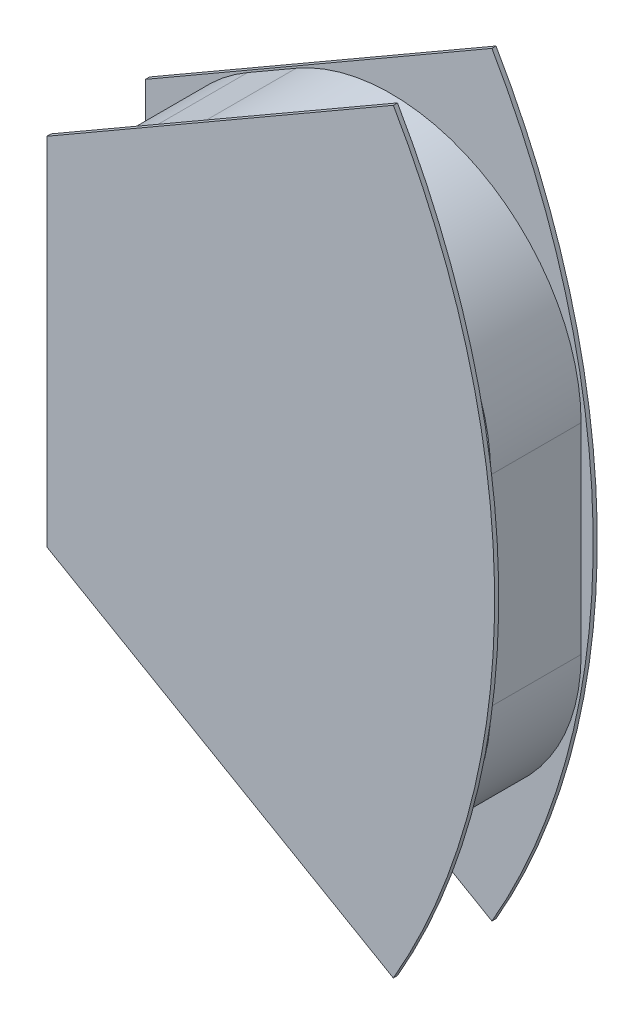
from build123d import *

# Parameters (mm, degrees)
BOSS_EXTRUDE1_START     = 20
BOSS_EXTRUDE1_DEPTH     = 1
BOSS_EXTRUDE2_DEPTH     = 22
SKETCH3_3_R             = 3.1
CUT_EXTRUDE1_DEPTH      = 10
BOSS_EXTRUDE3_START     = 22
SKETCH4_R               = 6.906241286
SKETCH4_R_2             = 3.1
BOSS_EXTRUDE3_DEPTH     = 22
BOSS_EXTRUDE4_START     = 1
BOSS_EXTRUDE4_DEPTH     = 22
BOSS_EXTRUDE4_2_DEPTH   = 22
BOSS_EXTRUDE5_DEPTH     = 1
BOSS_EXTRUDE6_START     = 0.5
BOSS_EXTRUDE6_DEPTH     = 22
CUT_EXTRUDE_THIN3_DEPTH = 22


with BuildPart() as part:
    # Sketch2 → Boss-Extrude1 (new body)
    with BuildSketch(Plane.XY.offset(BOSS_EXTRUDE1_START)):
        with BuildLine():
            Line((159.348674296, -92), (75, -43.301270189))
            Line((75, -43.301270189), (75, 43.301270189))
            Line((75, 43.301270189), (159.348674296, 92))
            ThreePointArc((159.348674296, 92), (184, 0), (159.348674296, -92))
        make_face()
    extrude(amount=BOSS_EXTRUDE1_DEPTH)

    # Sketch3 → Boss-Extrude2 (add)
    with BuildSketch(Plane.XY.offset(21)):
        with BuildLine():
            ThreePointArc((122.5, -17.60918321), (122.633974596, -18.10918321), (123, -18.475208614))
            Line((123, -18.475208614), (134.812482571, -25.295148606))
            ThreePointArc((134.812482571, -25.295148606), (135.812482571, -25.295148606), (136.312482571, -24.429123203))
            Line((136.312482571, -24.429123203), (136.312482571, 24.429123203))
            ThreePointArc((136.312482571, 24.429123203), (135.812482571, 25.295148606), (134.812482571, 25.295148606))
            Line((134.812482571, 25.295148606), (123, 18.475208614))
            ThreePointArc((123, 18.475208614), (122.633974596, 18.10918321), (122.5, 17.60918321))
            Line((122.5, 17.60918321), (122.5, -17.60918321))
        make_face()
        Polygon((134.312482571, 22.697072395), (134.312482571, -22.697072395), (124.5, -17.031832941), (124.5, 17.031832941), align=None, mode=Mode.SUBTRACT)
    extrude(amount=BOSS_EXTRUDE2_DEPTH)

    # Sketch3<3> → Cut-Extrude1 (cut)
    with BuildSketch(Plane.XY.offset(21)):
        with Locations((129.406241286, 0)):
            Circle(SKETCH3_3_R)
    extrude(amount=-CUT_EXTRUDE1_DEPTH, mode=Mode.SUBTRACT)

    # Sketch4 → Boss-Extrude3 (add)
    with BuildSketch(Plane.XY.offset(21).offset(BOSS_EXTRUDE3_START)):
        with Locations((129.406241286, 0)):
            Circle(SKETCH4_R)
        with Locations((129.406241286, 0)):
            Circle(SKETCH4_R_2, mode=Mode.SUBTRACT)
    extrude(amount=-BOSS_EXTRUDE3_DEPTH)


with BuildPart() as body_2:
    # Sketch5 → Boss-Extrude4 (new body)
    with BuildSketch(Plane.XY.offset(21).offset(BOSS_EXTRUDE4_START)):
        with BuildLine():
            Line((125, 16.743157806), (125, 5.952936058))
            ThreePointArc((125, 5.952936058), (129.406241286, 7.406241286), (133.812482571, 5.952936058))
            Line((133.812482571, 5.952936058), (133.812482571, 21.831046991))
            Line((133.812482571, 21.831046991), (125, 16.743157806))
        make_face()
    extrude(amount=BOSS_EXTRUDE4_DEPTH)



with BuildPart() as body_3:
    # Sketch5 → Boss-Extrude4 2 (new body)
    with BuildSketch(Plane.XY.offset(21).offset(BOSS_EXTRUDE4_START)):
        with BuildLine():
            Line((133.812482571, -21.831046991), (133.812482571, -5.952936058))
            ThreePointArc((133.812482571, -5.952936058), (129.406241286, -7.406241286), (125, -5.952936058))
            Line((125, -5.952936058), (125, -16.743157806))
            Line((125, -16.743157806), (133.812482571, -21.831046991))
        make_face()
    extrude(amount=BOSS_EXTRUDE4_2_DEPTH)


with BuildPart() as body_2_1:
    add(body_2.part)

    add(body_3.part)  # Boss-Extrude5 merges body 3
    # Sketch6 → Boss-Extrude5 (add)
    with BuildSketch(Plane.XY.offset(44)):
        with BuildLine():
            Line((159.348674296, 92), (75, 43.301270189))
            Line((75, 43.301270189), (75, -43.301270189))
            Line((75, -43.301270189), (159.348674296, -92))
            ThreePointArc((159.348674296, -92), (184, 0), (159.348674296, 92))
        make_face()
    extrude(amount=BOSS_EXTRUDE5_DEPTH)


with BuildPart() as body_3_2:
    # Sketch7 → Boss-Extrude6 (new body)
    with BuildSketch(Plane.XY.offset(21).offset(BOSS_EXTRUDE6_START)):
        with BuildLine():
            Line((181.562482571, -24.429123203), (181.562482571, 24.429123203))
            ThreePointArc((181.562482571, 24.429123203), (158.437482571, 64.482798128), (112.187482571, 64.482798128))
            Line((112.187482571, 64.482798128), (100.375, 57.662858135))
            ThreePointArc((100.375, 57.662858135), (83.446325075, 40.73418321), (77.25, 17.60918321))
            Line((77.25, 17.60918321), (77.25, -17.60918321))
            ThreePointArc((77.25, -17.60918321), (83.446325075, -40.73418321), (100.375, -57.662858135))
            Line((100.375, -57.662858135), (112.187482571, -64.482798128))
            ThreePointArc((112.187482571, -64.482798128), (158.437482571, -64.482798128), (181.562482571, -24.429123203))
        make_face()
        with BuildLine():
            ThreePointArc((136.562482571, 24.429123203), (135.937482571, 25.511654957), (134.687482571, 25.511654957))
            Line((134.687482571, 25.511654957), (122.875, 18.691714965))
            ThreePointArc((122.875, 18.691714965), (122.417468245, 18.23418321), (122.25, 17.60918321))
            Line((122.25, 17.60918321), (122.25, -17.60918321))
            ThreePointArc((122.25, -17.60918321), (122.417468245, -18.23418321), (122.875, -18.691714965))
            Line((122.875, -18.691714965), (134.687482571, -25.511654957))
            ThreePointArc((134.687482571, -25.511654957), (135.937482571, -25.511654957), (136.562482571, -24.429123203))
            Line((136.562482571, -24.429123203), (136.562482571, 24.429123203))
        make_face(mode=Mode.SUBTRACT)
    extrude(amount=BOSS_EXTRUDE6_DEPTH)

    # Sketch8 → Cut-Extrude-Thin3 (cut)
    # profile 1 of 26: a face of its own
    with BuildSketch(Plane.XY.offset(43.5)):
        with BuildLine():
            Line((113.212482571, 62.70744605), (101.4, 55.887506058))
            ThreePointArc((101.4, 55.887506058), (85.221677153, 39.70918321), (79.3, 17.60918321))
            Line((79.3, 17.60918321), (79.3, -17.60918321))
            ThreePointArc((79.3, -17.60918321), (85.221677153, -39.70918321), (101.4, -55.887506058))
            Line((101.4, -55.887506058), (113.212482571, -62.70744605))
            ThreePointArc((113.212482571, -62.70744605), (157.412482571, -62.70744605), (179.512482571, -24.429123203))
            Line((179.512482571, -24.429123203), (179.512482571, 24.429123203))
            ThreePointArc((179.512482571, 24.429123203), (157.412482571, 62.70744605), (113.212482571, 62.70744605))
        make_face()
        with BuildLine():
            Line((113.262482571, 62.620843509), (101.45, 55.800903517))
            ThreePointArc((101.45, 55.800903517), (85.308279693, 39.65918321), (79.4, 17.60918321))
            Line((79.4, 17.60918321), (79.4, -17.60918321))
            ThreePointArc((79.4, -17.60918321), (85.308279693, -39.65918321), (101.45, -55.800903517))
            Line((101.45, -55.800903517), (113.262482571, -62.620843509))
            ThreePointArc((113.262482571, -62.620843509), (157.362482571, -62.620843509), (179.412482571, -24.429123203))
            Line((179.412482571, -24.429123203), (179.412482571, 24.429123203))
            ThreePointArc((179.412482571, 24.429123203), (157.362482571, 62.620843509), (113.262482571, 62.620843509))
        make_face(mode=Mode.SUBTRACT)
    # profile 2 of 26: a face of its own
    with BuildSketch(Plane.XY.offset(43.5)):
        with BuildLine():
            Line((114.037482571, 61.278504134), (102.225, 54.458564141))
            ThreePointArc((102.225, 54.458564141), (86.650619069, 38.88418321), (80.95, 17.60918321))
            Line((80.95, 17.60918321), (80.95, -17.60918321))
            ThreePointArc((80.95, -17.60918321), (86.650619069, -38.88418321), (102.225, -54.458564141))
            Line((102.225, -54.458564141), (114.037482571, -61.278504134))
            ThreePointArc((114.037482571, -61.278504134), (156.587482571, -61.278504134), (177.862482571, -24.429123203))
            Line((177.862482571, -24.429123203), (177.862482571, 24.429123203))
            ThreePointArc((177.862482571, 24.429123203), (156.587482571, 61.278504134), (114.037482571, 61.278504134))
        make_face()
        with BuildLine():
            Line((114.087482571, 61.191901593), (102.275, 54.371961601))
            ThreePointArc((102.275, 54.371961601), (86.737221609, 38.83418321), (81.05, 17.60918321))
            Line((81.05, 17.60918321), (81.05, -17.60918321))
            ThreePointArc((81.05, -17.60918321), (86.737221609, -38.83418321), (102.275, -54.371961601))
            Line((102.275, -54.371961601), (114.087482571, -61.191901593))
            ThreePointArc((114.087482571, -61.191901593), (156.537482571, -61.191901593), (177.762482571, -24.429123203))
            Line((177.762482571, -24.429123203), (177.762482571, 24.429123203))
            ThreePointArc((177.762482571, 24.429123203), (156.537482571, 61.191901593), (114.087482571, 61.191901593))
        make_face(mode=Mode.SUBTRACT)
    # profile 3 of 26: a face of its own
    with BuildSketch(Plane.XY.offset(43.5)):
        with BuildLine():
            Line((114.862482571, 59.849562217), (103.05, 53.029622225))
            ThreePointArc((103.05, 53.029622225), (88.079560985, 38.05918321), (82.6, 17.60918321))
            Line((82.6, 17.60918321), (82.6, -17.60918321))
            ThreePointArc((82.6, -17.60918321), (88.079560985, -38.05918321), (103.05, -53.029622225))
            Line((103.05, -53.029622225), (114.862482571, -59.849562217))
            ThreePointArc((114.862482571, -59.849562217), (155.762482571, -59.849562217), (176.212482571, -24.429123203))
            Line((176.212482571, -24.429123203), (176.212482571, 24.429123203))
            ThreePointArc((176.212482571, 24.429123203), (155.762482571, 59.849562217), (114.862482571, 59.849562217))
        make_face()
        with BuildLine():
            Line((114.912482571, 59.762959677), (103.1, 52.943019685))
            ThreePointArc((103.1, 52.943019685), (88.166163526, 38.00918321), (82.7, 17.60918321))
            Line((82.7, 17.60918321), (82.7, -17.60918321))
            ThreePointArc((82.7, -17.60918321), (88.166163526, -38.00918321), (103.1, -52.943019685))
            Line((103.1, -52.943019685), (114.912482571, -59.762959677))
            ThreePointArc((114.912482571, -59.762959677), (155.712482571, -59.762959677), (176.112482571, -24.429123203))
            Line((176.112482571, -24.429123203), (176.112482571, 24.429123203))
            ThreePointArc((176.112482571, 24.429123203), (155.712482571, 59.762959677), (114.912482571, 59.762959677))
        make_face(mode=Mode.SUBTRACT)
    # profile 4 of 26: a face of its own
    with BuildSketch(Plane.XY.offset(43.5)):
        with BuildLine():
            Line((115.687482571, 58.420620301), (103.875, 51.600680309))
            ThreePointArc((103.875, 51.600680309), (89.508502901, 37.23418321), (84.25, 17.60918321))
            Line((84.25, 17.60918321), (84.25, -17.60918321))
            ThreePointArc((84.25, -17.60918321), (89.508502901, -37.23418321), (103.875, -51.600680309))
            Line((103.875, -51.600680309), (115.687482571, -58.420620301))
            ThreePointArc((115.687482571, -58.420620301), (154.937482571, -58.420620301), (174.562482571, -24.429123203))
            Line((174.562482571, -24.429123203), (174.562482571, 24.429123203))
            ThreePointArc((174.562482571, 24.429123203), (154.937482571, 58.420620301), (115.687482571, 58.420620301))
        make_face()
        with BuildLine():
            Line((115.737482571, 58.334017761), (103.925, 51.514077768))
            ThreePointArc((103.925, 51.514077768), (89.595105442, 37.18418321), (84.35, 17.60918321))
            Line((84.35, 17.60918321), (84.35, -17.60918321))
            ThreePointArc((84.35, -17.60918321), (89.595105442, -37.18418321), (103.925, -51.514077768))
            Line((103.925, -51.514077768), (115.737482571, -58.334017761))
            ThreePointArc((115.737482571, -58.334017761), (154.887482571, -58.334017761), (174.462482571, -24.429123203))
            Line((174.462482571, -24.429123203), (174.462482571, 24.429123203))
            ThreePointArc((174.462482571, 24.429123203), (154.887482571, 58.334017761), (115.737482571, 58.334017761))
        make_face(mode=Mode.SUBTRACT)
    # profile 5 of 26: a face of its own
    with BuildSketch(Plane.XY.offset(43.5)):
        with BuildLine():
            Line((116.512482571, 56.991678385), (104.7, 50.171738393))
            ThreePointArc((104.7, 50.171738393), (90.937444818, 36.40918321), (85.9, 17.60918321))
            Line((85.9, 17.60918321), (85.9, -17.60918321))
            ThreePointArc((85.9, -17.60918321), (90.937444818, -36.40918321), (104.7, -50.171738393))
            Line((104.7, -50.171738393), (116.512482571, -56.991678385))
            ThreePointArc((116.512482571, -56.991678385), (154.112482571, -56.991678385), (172.912482571, -24.429123203))
            Line((172.912482571, -24.429123203), (172.912482571, 24.429123203))
            ThreePointArc((172.912482571, 24.429123203), (154.112482571, 56.991678385), (116.512482571, 56.991678385))
        make_face()
        with BuildLine():
            Line((116.562482571, 56.905075844), (104.75, 50.085135852))
            ThreePointArc((104.75, 50.085135852), (91.024047358, 36.35918321), (86, 17.60918321))
            Line((86, 17.60918321), (86, -17.60918321))
            ThreePointArc((86, -17.60918321), (91.024047358, -36.35918321), (104.75, -50.085135852))
            Line((104.75, -50.085135852), (116.562482571, -56.905075844))
            ThreePointArc((116.562482571, -56.905075844), (154.062482571, -56.905075844), (172.812482571, -24.429123203))
            Line((172.812482571, -24.429123203), (172.812482571, 24.429123203))
            ThreePointArc((172.812482571, 24.429123203), (154.062482571, 56.905075844), (116.562482571, 56.905075844))
        make_face(mode=Mode.SUBTRACT)
    # profile 6 of 26: a face of its own
    with BuildSketch(Plane.XY.offset(43.5)):
        with BuildLine():
            Line((117.337482571, 55.562736469), (105.525, 48.742796476))
            ThreePointArc((105.525, 48.742796476), (92.366386734, 35.58418321), (87.55, 17.60918321))
            Line((87.55, 17.60918321), (87.55, -17.60918321))
            ThreePointArc((87.55, -17.60918321), (92.366386734, -35.58418321), (105.525, -48.742796476))
            Line((105.525, -48.742796476), (117.337482571, -55.562736469))
            ThreePointArc((117.337482571, -55.562736469), (153.287482571, -55.562736469), (171.262482571, -24.429123203))
            Line((171.262482571, -24.429123203), (171.262482571, 24.429123203))
            ThreePointArc((171.262482571, 24.429123203), (153.287482571, 55.562736469), (117.337482571, 55.562736469))
        make_face()
        with BuildLine():
            Line((117.387482571, 55.476133928), (105.575, 48.656193936))
            ThreePointArc((105.575, 48.656193936), (92.452989274, 35.53418321), (87.65, 17.60918321))
            Line((87.65, 17.60918321), (87.65, -17.60918321))
            ThreePointArc((87.65, -17.60918321), (92.452989274, -35.53418321), (105.575, -48.656193936))
            Line((105.575, -48.656193936), (117.387482571, -55.476133928))
            ThreePointArc((117.387482571, -55.476133928), (153.237482571, -55.476133928), (171.162482571, -24.429123203))
            Line((171.162482571, -24.429123203), (171.162482571, 24.429123203))
            ThreePointArc((171.162482571, 24.429123203), (153.237482571, 55.476133928), (117.387482571, 55.476133928))
        make_face(mode=Mode.SUBTRACT)
    # profile 7 of 26: a face of its own
    with BuildSketch(Plane.XY.offset(43.5)):
        with BuildLine():
            Line((118.162482571, 54.133794552), (106.35, 47.31385456))
            ThreePointArc((106.35, 47.31385456), (93.79532865, 34.75918321), (89.2, 17.60918321))
            Line((89.2, 17.60918321), (89.2, -17.60918321))
            ThreePointArc((89.2, -17.60918321), (93.79532865, -34.75918321), (106.35, -47.31385456))
            Line((106.35, -47.31385456), (118.162482571, -54.133794552))
            ThreePointArc((118.162482571, -54.133794552), (152.462482571, -54.133794552), (169.612482571, -24.429123203))
            Line((169.612482571, -24.429123203), (169.612482571, 24.429123203))
            ThreePointArc((169.612482571, 24.429123203), (152.462482571, 54.133794552), (118.162482571, 54.133794552))
        make_face()
        with BuildLine():
            Line((118.212482571, 54.047192012), (106.4, 47.22725202))
            ThreePointArc((106.4, 47.22725202), (93.881931191, 34.70918321), (89.3, 17.60918321))
            Line((89.3, 17.60918321), (89.3, -17.60918321))
            ThreePointArc((89.3, -17.60918321), (93.881931191, -34.70918321), (106.4, -47.22725202))
            Line((106.4, -47.22725202), (118.212482571, -54.047192012))
            ThreePointArc((118.212482571, -54.047192012), (152.412482571, -54.047192012), (169.512482571, -24.429123203))
            Line((169.512482571, -24.429123203), (169.512482571, 24.429123203))
            ThreePointArc((169.512482571, 24.429123203), (152.412482571, 54.047192012), (118.212482571, 54.047192012))
        make_face(mode=Mode.SUBTRACT)
    # profile 8 of 26: a face of its own
    with BuildSketch(Plane.XY.offset(43.5)):
        with BuildLine():
            Line((118.987482571, 52.704852636), (107.175, 45.884912644))
            ThreePointArc((107.175, 45.884912644), (95.224270566, 33.93418321), (90.85, 17.60918321))
            Line((90.85, 17.60918321), (90.85, -17.60918321))
            ThreePointArc((90.85, -17.60918321), (95.224270566, -33.93418321), (107.175, -45.884912644))
            Line((107.175, -45.884912644), (118.987482571, -52.704852636))
            ThreePointArc((118.987482571, -52.704852636), (151.637482571, -52.704852636), (167.962482571, -24.429123203))
            Line((167.962482571, -24.429123203), (167.962482571, 24.429123203))
            ThreePointArc((167.962482571, 24.429123203), (151.637482571, 52.704852636), (118.987482571, 52.704852636))
        make_face()
        with BuildLine():
            Line((119.037482571, 52.618250096), (107.225, 45.798310103))
            ThreePointArc((107.225, 45.798310103), (95.310873107, 33.88418321), (90.95, 17.60918321))
            Line((90.95, 17.60918321), (90.95, -17.60918321))
            ThreePointArc((90.95, -17.60918321), (95.310873107, -33.88418321), (107.225, -45.798310103))
            Line((107.225, -45.798310103), (119.037482571, -52.618250096))
            ThreePointArc((119.037482571, -52.618250096), (151.587482571, -52.618250096), (167.862482571, -24.429123203))
            Line((167.862482571, -24.429123203), (167.862482571, 24.429123203))
            ThreePointArc((167.862482571, 24.429123203), (151.587482571, 52.618250096), (119.037482571, 52.618250096))
        make_face(mode=Mode.SUBTRACT)
    # profile 9 of 26: a face of its own
    with BuildSketch(Plane.XY.offset(43.5)):
        with BuildLine():
            Line((119.812482571, 51.27591072), (108, 44.455970728))
            ThreePointArc((108, 44.455970728), (96.653212483, 33.10918321), (92.5, 17.60918321))
            Line((92.5, 17.60918321), (92.5, -17.60918321))
            ThreePointArc((92.5, -17.60918321), (96.653212483, -33.10918321), (108, -44.455970728))
            Line((108, -44.455970728), (119.812482571, -51.27591072))
            ThreePointArc((119.812482571, -51.27591072), (150.812482571, -51.27591072), (166.312482571, -24.429123203))
            Line((166.312482571, -24.429123203), (166.312482571, 24.429123203))
            ThreePointArc((166.312482571, 24.429123203), (150.812482571, 51.27591072), (119.812482571, 51.27591072))
        make_face()
        with BuildLine():
            Line((119.862482571, 51.189308179), (108.05, 44.369368187))
            ThreePointArc((108.05, 44.369368187), (96.739815023, 33.05918321), (92.6, 17.60918321))
            Line((92.6, 17.60918321), (92.6, -17.60918321))
            ThreePointArc((92.6, -17.60918321), (96.739815023, -33.05918321), (108.05, -44.369368187))
            Line((108.05, -44.369368187), (119.862482571, -51.189308179))
            ThreePointArc((119.862482571, -51.189308179), (150.762482571, -51.189308179), (166.212482571, -24.429123203))
            Line((166.212482571, -24.429123203), (166.212482571, 24.429123203))
            ThreePointArc((166.212482571, 24.429123203), (150.762482571, 51.189308179), (119.862482571, 51.189308179))
        make_face(mode=Mode.SUBTRACT)
    # profile 10 of 26: a face of its own
    with BuildSketch(Plane.XY.offset(43.5)):
        with BuildLine():
            Line((120.637482571, 49.846968804), (108.825, 43.027028811))
            ThreePointArc((108.825, 43.027028811), (98.082154399, 32.28418321), (94.15, 17.60918321))
            Line((94.15, 17.60918321), (94.15, -17.60918321))
            ThreePointArc((94.15, -17.60918321), (98.082154399, -32.28418321), (108.825, -43.027028811))
            Line((108.825, -43.027028811), (120.637482571, -49.846968804))
            ThreePointArc((120.637482571, -49.846968804), (149.987482571, -49.846968804), (164.662482571, -24.429123203))
            Line((164.662482571, -24.429123203), (164.662482571, 24.429123203))
            ThreePointArc((164.662482571, 24.429123203), (149.987482571, 49.846968804), (120.637482571, 49.846968804))
        make_face()
        with BuildLine():
            Line((120.687482571, 49.760366263), (108.875, 42.940426271))
            ThreePointArc((108.875, 42.940426271), (98.168756939, 32.23418321), (94.25, 17.60918321))
            Line((94.25, 17.60918321), (94.25, -17.60918321))
            ThreePointArc((94.25, -17.60918321), (98.168756939, -32.23418321), (108.875, -42.940426271))
            Line((108.875, -42.940426271), (120.687482571, -49.760366263))
            ThreePointArc((120.687482571, -49.760366263), (149.937482571, -49.760366263), (164.562482571, -24.429123203))
            Line((164.562482571, -24.429123203), (164.562482571, 24.429123203))
            ThreePointArc((164.562482571, 24.429123203), (149.937482571, 49.760366263), (120.687482571, 49.760366263))
        make_face(mode=Mode.SUBTRACT)
    # profile 11 of 26: a face of its own
    with BuildSketch(Plane.XY.offset(43.5)):
        with BuildLine():
            Line((109.65, -41.598086895), (121.462482571, -48.418026887))
            ThreePointArc((121.462482571, -48.418026887), (149.162482571, -48.418026887), (163.012482571, -24.429123203))
            Line((163.012482571, -24.429123203), (163.012482571, 24.429123203))
            ThreePointArc((163.012482571, 24.429123203), (149.162482571, 48.418026887), (121.462482571, 48.418026887))
            Line((121.462482571, 48.418026887), (109.65, 41.598086895))
            ThreePointArc((109.65, 41.598086895), (99.511096315, 31.45918321), (95.8, 17.60918321))
            Line((95.8, 17.60918321), (95.8, -17.60918321))
            ThreePointArc((95.8, -17.60918321), (99.511096315, -31.45918321), (109.65, -41.598086895))
        make_face()
        with BuildLine():
            Line((109.7, -41.511484355), (121.512482571, -48.331424347))
            ThreePointArc((121.512482571, -48.331424347), (149.112482571, -48.331424347), (162.912482571, -24.429123203))
            Line((162.912482571, -24.429123203), (162.912482571, 24.429123203))
            ThreePointArc((162.912482571, 24.429123203), (149.112482571, 48.331424347), (121.512482571, 48.331424347))
            Line((121.512482571, 48.331424347), (109.7, 41.511484355))
            ThreePointArc((109.7, 41.511484355), (99.597698856, 31.40918321), (95.9, 17.60918321))
            Line((95.9, 17.60918321), (95.9, -17.60918321))
            ThreePointArc((95.9, -17.60918321), (99.597698856, -31.40918321), (109.7, -41.511484355))
        make_face(mode=Mode.SUBTRACT)
    # profile 12 of 26: a face of its own
    with BuildSketch(Plane.XY.offset(43.5)):
        with BuildLine():
            Line((110.475, -40.169144979), (122.287482571, -46.989084971))
            ThreePointArc((122.287482571, -46.989084971), (148.337482571, -46.989084971), (161.362482571, -24.429123203))
            Line((161.362482571, -24.429123203), (161.362482571, 24.429123203))
            ThreePointArc((161.362482571, 24.429123203), (148.337482571, 46.989084971), (122.287482571, 46.989084971))
            Line((122.287482571, 46.989084971), (110.475, 40.169144979))
            ThreePointArc((110.475, 40.169144979), (100.940038231, 30.63418321), (97.45, 17.60918321))
            Line((97.45, 17.60918321), (97.45, -17.60918321))
            ThreePointArc((97.45, -17.60918321), (100.940038231, -30.63418321), (110.475, -40.169144979))
        make_face()
        with BuildLine():
            Line((110.525, -40.082542438), (122.337482571, -46.902482431))
            ThreePointArc((122.337482571, -46.902482431), (148.287482571, -46.902482431), (161.262482571, -24.429123203))
            Line((161.262482571, -24.429123203), (161.262482571, 24.429123203))
            ThreePointArc((161.262482571, 24.429123203), (148.287482571, 46.902482431), (122.337482571, 46.902482431))
            Line((122.337482571, 46.902482431), (110.525, 40.082542438))
            ThreePointArc((110.525, 40.082542438), (101.026640772, 30.58418321), (97.55, 17.60918321))
            Line((97.55, 17.60918321), (97.55, -17.60918321))
            ThreePointArc((97.55, -17.60918321), (101.026640772, -30.58418321), (110.525, -40.082542438))
        make_face(mode=Mode.SUBTRACT)
    # profile 13 of 26: a face of its own
    with BuildSketch(Plane.XY.offset(43.5)):
        with BuildLine():
            Line((111.3, -38.740203063), (123.112482571, -45.560143055))
            ThreePointArc((123.112482571, -45.560143055), (147.512482571, -45.560143055), (159.712482571, -24.429123203))
            Line((159.712482571, -24.429123203), (159.712482571, 24.429123203))
            ThreePointArc((159.712482571, 24.429123203), (147.512482571, 45.560143055), (123.112482571, 45.560143055))
            Line((123.112482571, 45.560143055), (111.3, 38.740203063))
            ThreePointArc((111.3, 38.740203063), (102.368980148, 29.80918321), (99.1, 17.60918321))
            Line((99.1, 17.60918321), (99.1, -17.60918321))
            ThreePointArc((99.1, -17.60918321), (102.368980148, -29.80918321), (111.3, -38.740203063))
        make_face()
        with BuildLine():
            Line((111.35, -38.653600522), (123.162482571, -45.473540514))
            ThreePointArc((123.162482571, -45.473540514), (147.462482571, -45.473540514), (159.612482571, -24.429123203))
            Line((159.612482571, -24.429123203), (159.612482571, 24.429123203))
            ThreePointArc((159.612482571, 24.429123203), (147.462482571, 45.473540514), (123.162482571, 45.473540514))
            Line((123.162482571, 45.473540514), (111.35, 38.653600522))
            ThreePointArc((111.35, 38.653600522), (102.455582688, 29.75918321), (99.2, 17.60918321))
            Line((99.2, 17.60918321), (99.2, -17.60918321))
            ThreePointArc((99.2, -17.60918321), (102.455582688, -29.75918321), (111.35, -38.653600522))
        make_face(mode=Mode.SUBTRACT)
    # profile 14 of 26: a face of its own
    with BuildSketch(Plane.XY.offset(43.5)):
        with BuildLine():
            Line((112.125, -37.311261146), (123.937482571, -44.131201139))
            ThreePointArc((123.937482571, -44.131201139), (146.687482571, -44.131201139), (158.062482571, -24.429123203))
            Line((158.062482571, -24.429123203), (158.062482571, 24.429123203))
            ThreePointArc((158.062482571, 24.429123203), (146.687482571, 44.131201139), (123.937482571, 44.131201139))
            Line((123.937482571, 44.131201139), (112.125, 37.311261146))
            ThreePointArc((112.125, 37.311261146), (103.797922064, 28.98418321), (100.75, 17.60918321))
            Line((100.75, 17.60918321), (100.75, -17.60918321))
            ThreePointArc((100.75, -17.60918321), (103.797922064, -28.98418321), (112.125, -37.311261146))
        make_face()
        with BuildLine():
            Line((112.175, -37.224658606), (123.987482571, -44.044598598))
            ThreePointArc((123.987482571, -44.044598598), (146.637482571, -44.044598598), (157.962482571, -24.429123203))
            Line((157.962482571, -24.429123203), (157.962482571, 24.429123203))
            ThreePointArc((157.962482571, 24.429123203), (146.637482571, 44.044598598), (123.987482571, 44.044598598))
            Line((123.987482571, 44.044598598), (112.175, 37.224658606))
            ThreePointArc((112.175, 37.224658606), (103.884524604, 28.93418321), (100.85, 17.60918321))
            Line((100.85, 17.60918321), (100.85, -17.60918321))
            ThreePointArc((100.85, -17.60918321), (103.884524604, -28.93418321), (112.175, -37.224658606))
        make_face(mode=Mode.SUBTRACT)
    # profile 15 of 26: a face of its own
    with BuildSketch(Plane.XY.offset(43.5)):
        with BuildLine():
            Line((112.95, -35.88231923), (124.762482571, -42.702259222))
            ThreePointArc((124.762482571, -42.702259222), (145.862482571, -42.702259222), (156.412482571, -24.429123203))
            Line((156.412482571, -24.429123203), (156.412482571, 24.429123203))
            ThreePointArc((156.412482571, 24.429123203), (145.862482571, 42.702259222), (124.762482571, 42.702259222))
            Line((124.762482571, 42.702259222), (112.95, 35.88231923))
            ThreePointArc((112.95, 35.88231923), (105.22686398, 28.15918321), (102.4, 17.60918321))
            Line((102.4, 17.60918321), (102.4, -17.60918321))
            ThreePointArc((102.4, -17.60918321), (105.22686398, -28.15918321), (112.95, -35.88231923))
        make_face()
        with BuildLine():
            Line((113, -35.79571669), (124.812482571, -42.615656682))
            ThreePointArc((124.812482571, -42.615656682), (145.812482571, -42.615656682), (156.312482571, -24.429123203))
            Line((156.312482571, -24.429123203), (156.312482571, 24.429123203))
            ThreePointArc((156.312482571, 24.429123203), (145.812482571, 42.615656682), (124.812482571, 42.615656682))
            Line((124.812482571, 42.615656682), (113, 35.79571669))
            ThreePointArc((113, 35.79571669), (105.313466521, 28.10918321), (102.5, 17.60918321))
            Line((102.5, 17.60918321), (102.5, -17.60918321))
            ThreePointArc((102.5, -17.60918321), (105.313466521, -28.10918321), (113, -35.79571669))
        make_face(mode=Mode.SUBTRACT)
    # profile 16 of 26: a face of its own
    with BuildSketch(Plane.XY.offset(43.5)):
        with BuildLine():
            Line((113.775, -34.453377314), (125.587482571, -41.273317306))
            ThreePointArc((125.587482571, -41.273317306), (145.037482571, -41.273317306), (154.762482571, -24.429123203))
            Line((154.762482571, -24.429123203), (154.762482571, 24.429123203))
            ThreePointArc((154.762482571, 24.429123203), (145.037482571, 41.273317306), (125.587482571, 41.273317306))
            Line((125.587482571, 41.273317306), (113.775, 34.453377314))
            ThreePointArc((113.775, 34.453377314), (106.655805896, 27.33418321), (104.05, 17.60918321))
            Line((104.05, 17.60918321), (104.05, -17.60918321))
            ThreePointArc((104.05, -17.60918321), (106.655805896, -27.33418321), (113.775, -34.453377314))
        make_face()
        with BuildLine():
            Line((113.825, -34.366774774), (125.637482571, -41.186714766))
            ThreePointArc((125.637482571, -41.186714766), (144.987482571, -41.186714766), (154.662482571, -24.429123203))
            Line((154.662482571, -24.429123203), (154.662482571, 24.429123203))
            ThreePointArc((154.662482571, 24.429123203), (144.987482571, 41.186714766), (125.637482571, 41.186714766))
            Line((125.637482571, 41.186714766), (113.825, 34.366774774))
            ThreePointArc((113.825, 34.366774774), (106.742408437, 27.28418321), (104.15, 17.60918321))
            Line((104.15, 17.60918321), (104.15, -17.60918321))
            ThreePointArc((104.15, -17.60918321), (106.742408437, -27.28418321), (113.825, -34.366774774))
        make_face(mode=Mode.SUBTRACT)
    # profile 17 of 26: a face of its own
    with BuildSketch(Plane.XY.offset(43.5)):
        with BuildLine():
            Line((114.6, -33.024435398), (126.412482571, -39.84437539))
            ThreePointArc((126.412482571, -39.84437539), (144.212482571, -39.84437539), (153.112482571, -24.429123203))
            Line((153.112482571, -24.429123203), (153.112482571, 24.429123203))
            ThreePointArc((153.112482571, 24.429123203), (144.212482571, 39.84437539), (126.412482571, 39.84437539))
            Line((126.412482571, 39.84437539), (114.6, 33.024435398))
            ThreePointArc((114.6, 33.024435398), (108.084747813, 26.50918321), (105.7, 17.60918321))
            Line((105.7, 17.60918321), (105.7, -17.60918321))
            ThreePointArc((105.7, -17.60918321), (108.084747813, -26.50918321), (114.6, -33.024435398))
        make_face()
        with BuildLine():
            Line((114.65, -32.937832857), (126.462482571, -39.757772849))
            ThreePointArc((126.462482571, -39.757772849), (144.162482571, -39.757772849), (153.012482571, -24.429123203))
            Line((153.012482571, -24.429123203), (153.012482571, 24.429123203))
            ThreePointArc((153.012482571, 24.429123203), (144.162482571, 39.757772849), (126.462482571, 39.757772849))
            Line((126.462482571, 39.757772849), (114.65, 32.937832857))
            ThreePointArc((114.65, 32.937832857), (108.171350353, 26.45918321), (105.8, 17.60918321))
            Line((105.8, 17.60918321), (105.8, -17.60918321))
            ThreePointArc((105.8, -17.60918321), (108.171350353, -26.45918321), (114.65, -32.937832857))
        make_face(mode=Mode.SUBTRACT)
    # profile 18 of 26: a face of its own
    with BuildSketch(Plane.XY.offset(43.5)):
        with BuildLine():
            Line((115.425, -31.595493481), (127.237482571, -38.415433474))
            ThreePointArc((127.237482571, -38.415433474), (143.387482571, -38.415433474), (151.462482571, -24.429123203))
            Line((151.462482571, -24.429123203), (151.462482571, 24.429123203))
            ThreePointArc((151.462482571, 24.429123203), (143.387482571, 38.415433474), (127.237482571, 38.415433474))
            Line((127.237482571, 38.415433474), (115.425, 31.595493481))
            ThreePointArc((115.425, 31.595493481), (109.513689729, 25.68418321), (107.35, 17.60918321))
            Line((107.35, 17.60918321), (107.35, -17.60918321))
            ThreePointArc((107.35, -17.60918321), (109.513689729, -25.68418321), (115.425, -31.595493481))
        make_face()
        with BuildLine():
            Line((115.475, -31.508890941), (127.287482571, -38.328830933))
            ThreePointArc((127.287482571, -38.328830933), (143.337482571, -38.328830933), (151.362482571, -24.429123203))
            Line((151.362482571, -24.429123203), (151.362482571, 24.429123203))
            ThreePointArc((151.362482571, 24.429123203), (143.337482571, 38.328830933), (127.287482571, 38.328830933))
            Line((127.287482571, 38.328830933), (115.475, 31.508890941))
            ThreePointArc((115.475, 31.508890941), (109.600292269, 25.63418321), (107.45, 17.60918321))
            Line((107.45, 17.60918321), (107.45, -17.60918321))
            ThreePointArc((107.45, -17.60918321), (109.600292269, -25.63418321), (115.475, -31.508890941))
        make_face(mode=Mode.SUBTRACT)
    # profile 19 of 26: a face of its own
    with BuildSketch(Plane.XY.offset(43.5)):
        with BuildLine():
            Line((116.25, -30.166551565), (128.062482571, -36.986491557))
            ThreePointArc((128.062482571, -36.986491557), (142.562482571, -36.986491557), (149.812482571, -24.429123203))
            Line((149.812482571, -24.429123203), (149.812482571, 24.429123203))
            ThreePointArc((149.812482571, 24.429123203), (142.562482571, 36.986491557), (128.062482571, 36.986491557))
            Line((128.062482571, 36.986491557), (116.25, 30.166551565))
            ThreePointArc((116.25, 30.166551565), (110.942631645, 24.85918321), (109, 17.60918321))
            Line((109, 17.60918321), (109, -17.60918321))
            ThreePointArc((109, -17.60918321), (110.942631645, -24.85918321), (116.25, -30.166551565))
        make_face()
        with BuildLine():
            Line((116.3, -30.079949025), (128.112482571, -36.899889017))
            ThreePointArc((128.112482571, -36.899889017), (142.512482571, -36.899889017), (149.712482571, -24.429123203))
            Line((149.712482571, -24.429123203), (149.712482571, 24.429123203))
            ThreePointArc((149.712482571, 24.429123203), (142.512482571, 36.899889017), (128.112482571, 36.899889017))
            Line((128.112482571, 36.899889017), (116.3, 30.079949025))
            ThreePointArc((116.3, 30.079949025), (111.029234186, 24.80918321), (109.1, 17.60918321))
            Line((109.1, 17.60918321), (109.1, -17.60918321))
            ThreePointArc((109.1, -17.60918321), (111.029234186, -24.80918321), (116.3, -30.079949025))
        make_face(mode=Mode.SUBTRACT)
    # profile 20 of 26: a face of its own
    with BuildSketch(Plane.XY.offset(43.5)):
        with BuildLine():
            Line((117.075, -28.737609649), (128.887482571, -35.557549641))
            ThreePointArc((128.887482571, -35.557549641), (141.737482571, -35.557549641), (148.162482571, -24.429123203))
            Line((148.162482571, -24.429123203), (148.162482571, 24.429123203))
            ThreePointArc((148.162482571, 24.429123203), (141.737482571, 35.557549641), (128.887482571, 35.557549641))
            Line((128.887482571, 35.557549641), (117.075, 28.737609649))
            ThreePointArc((117.075, 28.737609649), (112.371573561, 24.03418321), (110.65, 17.60918321))
            Line((110.65, 17.60918321), (110.65, -17.60918321))
            ThreePointArc((110.65, -17.60918321), (112.371573561, -24.03418321), (117.075, -28.737609649))
        make_face()
        with BuildLine():
            Line((117.125, -28.651007109), (128.937482571, -35.470947101))
            ThreePointArc((128.937482571, -35.470947101), (141.687482571, -35.470947101), (148.062482571, -24.429123203))
            Line((148.062482571, -24.429123203), (148.062482571, 24.429123203))
            ThreePointArc((148.062482571, 24.429123203), (141.687482571, 35.470947101), (128.937482571, 35.470947101))
            Line((128.937482571, 35.470947101), (117.125, 28.651007109))
            ThreePointArc((117.125, 28.651007109), (112.458176102, 23.98418321), (110.75, 17.60918321))
            Line((110.75, 17.60918321), (110.75, -17.60918321))
            ThreePointArc((110.75, -17.60918321), (112.458176102, -23.98418321), (117.125, -28.651007109))
        make_face(mode=Mode.SUBTRACT)
    # profile 21 of 26: a face of its own
    with BuildSketch(Plane.XY.offset(43.5)):
        with BuildLine():
            Line((117.9, -27.308667733), (129.712482571, -34.128607725))
            ThreePointArc((129.712482571, -34.128607725), (140.912482571, -34.128607725), (146.512482571, -24.429123203))
            Line((146.512482571, -24.429123203), (146.512482571, 24.429123203))
            ThreePointArc((146.512482571, 24.429123203), (140.912482571, 34.128607725), (129.712482571, 34.128607725))
            Line((129.712482571, 34.128607725), (117.9, 27.308667733))
            ThreePointArc((117.9, 27.308667733), (113.800515478, 23.20918321), (112.3, 17.60918321))
            Line((112.3, 17.60918321), (112.3, -17.60918321))
            ThreePointArc((112.3, -17.60918321), (113.800515478, -23.20918321), (117.9, -27.308667733))
        make_face()
        with BuildLine():
            Line((117.95, -27.222065192), (129.762482571, -34.042005185))
            ThreePointArc((129.762482571, -34.042005185), (140.862482571, -34.042005185), (146.412482571, -24.429123203))
            Line((146.412482571, -24.429123203), (146.412482571, 24.429123203))
            ThreePointArc((146.412482571, 24.429123203), (140.862482571, 34.042005185), (129.762482571, 34.042005185))
            Line((129.762482571, 34.042005185), (117.95, 27.222065192))
            ThreePointArc((117.95, 27.222065192), (113.887118018, 23.15918321), (112.4, 17.60918321))
            Line((112.4, 17.60918321), (112.4, -17.60918321))
            ThreePointArc((112.4, -17.60918321), (113.887118018, -23.15918321), (117.95, -27.222065192))
        make_face(mode=Mode.SUBTRACT)
    # profile 22 of 26: a face of its own
    with BuildSketch(Plane.XY.offset(43.5)):
        with BuildLine():
            Line((118.725, -25.879725816), (130.537482571, -32.699665809))
            ThreePointArc((130.537482571, -32.699665809), (140.087482571, -32.699665809), (144.862482571, -24.429123203))
            Line((144.862482571, -24.429123203), (144.862482571, 24.429123203))
            ThreePointArc((144.862482571, 24.429123203), (140.087482571, 32.699665809), (130.537482571, 32.699665809))
            Line((130.537482571, 32.699665809), (118.725, 25.879725816))
            ThreePointArc((118.725, 25.879725816), (115.229457394, 22.38418321), (113.95, 17.60918321))
            Line((113.95, 17.60918321), (113.95, -17.60918321))
            ThreePointArc((113.95, -17.60918321), (115.229457394, -22.38418321), (118.725, -25.879725816))
        make_face()
        with BuildLine():
            Line((118.775, -25.793123276), (130.587482571, -32.613063268))
            ThreePointArc((130.587482571, -32.613063268), (140.037482571, -32.613063268), (144.762482571, -24.429123203))
            Line((144.762482571, -24.429123203), (144.762482571, 24.429123203))
            ThreePointArc((144.762482571, 24.429123203), (140.037482571, 32.613063268), (130.587482571, 32.613063268))
            Line((130.587482571, 32.613063268), (118.775, 25.793123276))
            ThreePointArc((118.775, 25.793123276), (115.316059934, 22.33418321), (114.05, 17.60918321))
            Line((114.05, 17.60918321), (114.05, -17.60918321))
            ThreePointArc((114.05, -17.60918321), (115.316059934, -22.33418321), (118.775, -25.793123276))
        make_face(mode=Mode.SUBTRACT)
    # profile 23 of 26: a face of its own
    with BuildSketch(Plane.XY.offset(43.5)):
        with BuildLine():
            Line((119.55, -24.4507839), (131.362482571, -31.270723892))
            ThreePointArc((131.362482571, -31.270723892), (139.262482571, -31.270723892), (143.212482571, -24.429123203))
            Line((143.212482571, -24.429123203), (143.212482571, 24.429123203))
            ThreePointArc((143.212482571, 24.429123203), (139.262482571, 31.270723892), (131.362482571, 31.270723892))
            Line((131.362482571, 31.270723892), (119.55, 24.4507839))
            ThreePointArc((119.55, 24.4507839), (116.65839931, 21.55918321), (115.6, 17.60918321))
            Line((115.6, 17.60918321), (115.6, -17.60918321))
            ThreePointArc((115.6, -17.60918321), (116.65839931, -21.55918321), (119.55, -24.4507839))
        make_face()
        with BuildLine():
            Line((119.6, -24.36418136), (131.412482571, -31.184121352))
            ThreePointArc((131.412482571, -31.184121352), (139.212482571, -31.184121352), (143.112482571, -24.429123203))
            Line((143.112482571, -24.429123203), (143.112482571, 24.429123203))
            ThreePointArc((143.112482571, 24.429123203), (139.212482571, 31.184121352), (131.412482571, 31.184121352))
            Line((131.412482571, 31.184121352), (119.6, 24.36418136))
            ThreePointArc((119.6, 24.36418136), (116.74500185, 21.50918321), (115.7, 17.60918321))
            Line((115.7, 17.60918321), (115.7, -17.60918321))
            ThreePointArc((115.7, -17.60918321), (116.74500185, -21.50918321), (119.6, -24.36418136))
        make_face(mode=Mode.SUBTRACT)
    # profile 24 of 26: a face of its own
    with BuildSketch(Plane.XY.offset(43.5)):
        with BuildLine():
            Line((120.375, -23.021841984), (132.187482571, -29.841781976))
            ThreePointArc((132.187482571, -29.841781976), (138.437482571, -29.841781976), (141.562482571, -24.429123203))
            Line((141.562482571, -24.429123203), (141.562482571, 24.429123203))
            ThreePointArc((141.562482571, 24.429123203), (138.437482571, 29.841781976), (132.187482571, 29.841781976))
            Line((132.187482571, 29.841781976), (120.375, 23.021841984))
            ThreePointArc((120.375, 23.021841984), (118.087341226, 20.73418321), (117.25, 17.60918321))
            Line((117.25, 17.60918321), (117.25, -17.60918321))
            ThreePointArc((117.25, -17.60918321), (118.087341226, -20.73418321), (120.375, -23.021841984))
        make_face()
        with BuildLine():
            Line((120.425, -22.935239444), (132.237482571, -29.755179436))
            ThreePointArc((132.237482571, -29.755179436), (138.387482571, -29.755179436), (141.462482571, -24.429123203))
            Line((141.462482571, -24.429123203), (141.462482571, 24.429123203))
            ThreePointArc((141.462482571, 24.429123203), (138.387482571, 29.755179436), (132.237482571, 29.755179436))
            Line((132.237482571, 29.755179436), (120.425, 22.935239444))
            ThreePointArc((120.425, 22.935239444), (118.173943767, 20.68418321), (117.35, 17.60918321))
            Line((117.35, 17.60918321), (117.35, -17.60918321))
            ThreePointArc((117.35, -17.60918321), (118.173943767, -20.68418321), (120.425, -22.935239444))
        make_face(mode=Mode.SUBTRACT)
    # profile 25 of 26: a face of its own
    with BuildSketch(Plane.XY.offset(43.5)):
        with BuildLine():
            Line((121.2, -21.592900068), (133.012482571, -28.41284006))
            ThreePointArc((133.012482571, -28.41284006), (137.612482571, -28.41284006), (139.912482571, -24.429123203))
            Line((139.912482571, -24.429123203), (139.912482571, 24.429123203))
            ThreePointArc((139.912482571, 24.429123203), (137.612482571, 28.41284006), (133.012482571, 28.41284006))
            Line((133.012482571, 28.41284006), (121.2, 21.592900068))
            ThreePointArc((121.2, 21.592900068), (119.516283143, 19.90918321), (118.9, 17.60918321))
            Line((118.9, 17.60918321), (118.9, -17.60918321))
            ThreePointArc((118.9, -17.60918321), (119.516283143, -19.90918321), (121.2, -21.592900068))
        make_face()
        with BuildLine():
            Line((121.25, -21.506297527), (133.062482571, -28.32623752))
            ThreePointArc((133.062482571, -28.32623752), (137.562482571, -28.32623752), (139.812482571, -24.429123203))
            Line((139.812482571, -24.429123203), (139.812482571, 24.429123203))
            ThreePointArc((139.812482571, 24.429123203), (137.562482571, 28.32623752), (133.062482571, 28.32623752))
            Line((133.062482571, 28.32623752), (121.25, 21.506297527))
            ThreePointArc((121.25, 21.506297527), (119.602885683, 19.85918321), (119, 17.60918321))
            Line((119, 17.60918321), (119, -17.60918321))
            ThreePointArc((119, -17.60918321), (119.602885683, -19.85918321), (121.25, -21.506297527))
        make_face(mode=Mode.SUBTRACT)
    # profile 26 of 26: a face of its own
    with BuildSketch(Plane.XY.offset(43.5)):
        with BuildLine():
            Line((133.837482571, 26.983898144), (122.025, 20.163958151))
            ThreePointArc((122.025, 20.163958151), (120.945225059, 19.08418321), (120.55, 17.60918321))
            Line((120.55, 17.60918321), (120.55, -17.60918321))
            ThreePointArc((120.55, -17.60918321), (120.945225059, -19.08418321), (122.025, -20.163958151))
            Line((122.025, -20.163958151), (133.837482571, -26.983898144))
            ThreePointArc((133.837482571, -26.983898144), (136.787482571, -26.983898144), (138.262482571, -24.429123203))
            Line((138.262482571, -24.429123203), (138.262482571, 24.429123203))
            ThreePointArc((138.262482571, 24.429123203), (136.787482571, 26.983898144), (133.837482571, 26.983898144))
        make_face()
        with BuildLine():
            Line((133.887482571, 26.897295603), (122.075, 20.077355611))
            ThreePointArc((122.075, 20.077355611), (121.031827599, 19.03418321), (120.65, 17.60918321))
            Line((120.65, 17.60918321), (120.65, -17.60918321))
            ThreePointArc((120.65, -17.60918321), (121.031827599, -19.03418321), (122.075, -20.077355611))
            Line((122.075, -20.077355611), (133.887482571, -26.897295603))
            ThreePointArc((133.887482571, -26.897295603), (136.737482571, -26.897295603), (138.162482571, -24.429123203))
            Line((138.162482571, -24.429123203), (138.162482571, 24.429123203))
            ThreePointArc((138.162482571, 24.429123203), (136.737482571, 26.897295603), (133.887482571, 26.897295603))
        make_face(mode=Mode.SUBTRACT)
    extrude(amount=-CUT_EXTRUDE_THIN3_DEPTH, mode=Mode.SUBTRACT)


solid = Compound([part.part, body_2_1.part, body_3_2.part])
